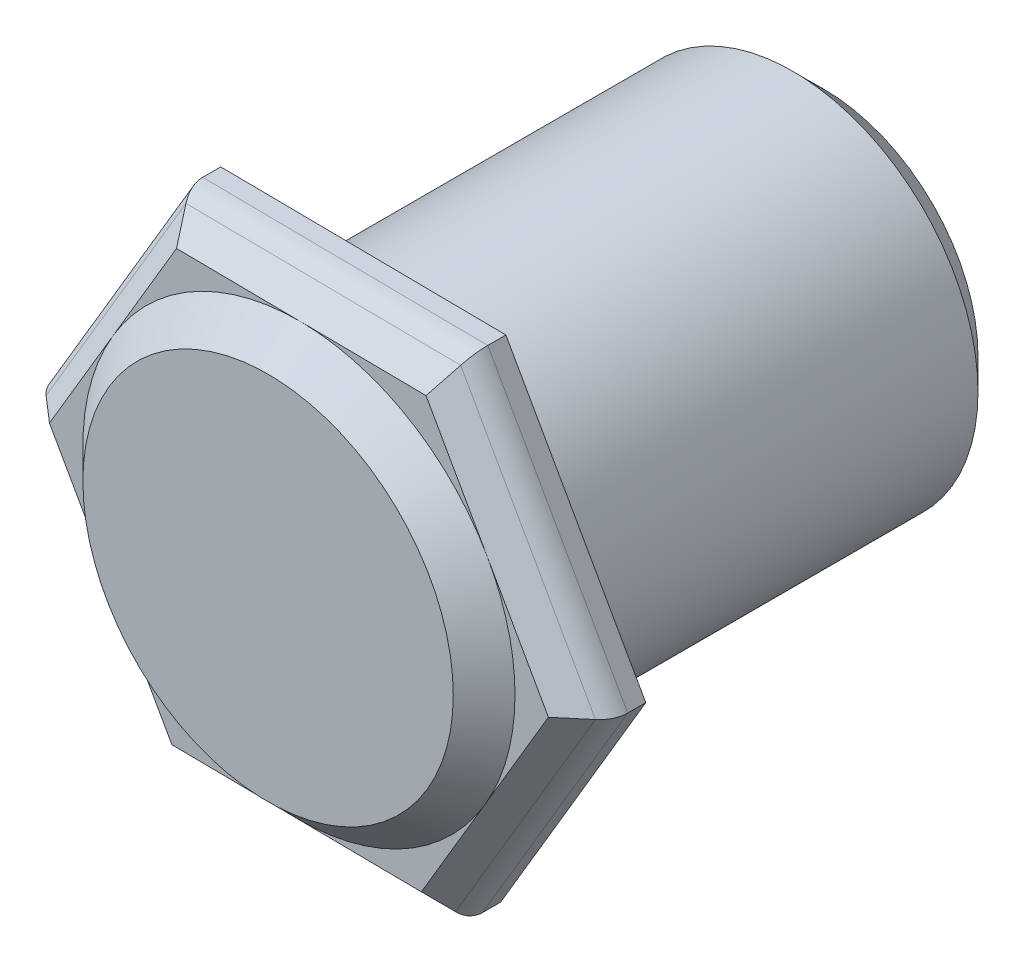
from build123d import *

# Parameters (mm, degrees)
SKETCH_1_R          = 6
EXTRUDE_1_DEPTH     = 15
EXTRUDE_2_DEPTH     = 2
SKETCH_3_R          = 7
EXTRUDE_3_DEPTH     = 1
CHAMFER_1_SIZE      = 1
FILLET_1_R          = 1
SKETCH_4_R          = 5
CUT_EXTRUDE_1_DEPTH = 10


with BuildPart() as part:
    # 草图1 → 凸台-拉伸1 (new body)
    with BuildSketch(Plane.XY):
        Circle(SKETCH_1_R)
    extrude(amount=EXTRUDE_1_DEPTH)

    # 草图2 → 凸台-拉伸2 (add)
    with BuildSketch(Plane.XY.offset(15)):
        Polygon((4.70381444, 7.950312136), (-4.533265058, 8.048778867), (-9.237079497, 0.098466732), (-4.70381444, -7.950312136), (4.533265058, -8.048778867), (9.237079497, -0.098466732), align=None)
    extrude(amount=EXTRUDE_2_DEPTH)

    # 草图3 → 凸台-拉伸3 (add)
    with BuildSketch(Plane.XY.offset(17)):
        Circle(SKETCH_3_R)
    extrude(amount=EXTRUDE_3_DEPTH)

    # 倒角1
    chamfer_1_edges = [part.edges().sort_by_distance(p)[0] for p in [
        (-6, 0, 0),
        (-7, 0, 18),
        (6.970446968, 3.925922702, 17),
        (0.085274691, 7.999545501, 17),
        (-6.885172277, 4.073622799, 17),
        (-6.970446968, -3.925922702, 17),
        (-0.085274691, -7.999545501, 17),
        (6.885172277, -4.073622799, 17),
    ]]
    chamfer(chamfer_1_edges, length=CHAMFER_1_SIZE - 0.0001)  # a hair under: the kernel refuses the full size

    # 圆角1
    fillet_1_edges = [part.edges().sort_by_distance(p)[0] for p in [
        (-6.885172277, 4.073622799, 16.0001),
        (0.085274691, 7.999545501, 16.0001),
        (6.970446968, 3.925922702, 16.0001),
        (6.885172277, -4.073622799, 16.0001),
        (-6.970446968, -3.925922702, 16.0001),
        (-0.085274691, -7.999545501, 16.0001),
    ]]
    fillet(fillet_1_edges, radius=FILLET_1_R)

    # 草图4 → 切除-拉伸1 (cut)
    with BuildSketch(Plane(origin=(0, 0, 0), x_dir=(-1, 0, 0), z_dir=(0, 0, -1))):
        Circle(SKETCH_4_R)
    extrude(amount=-CUT_EXTRUDE_1_DEPTH, mode=Mode.SUBTRACT)


solid = part.part
